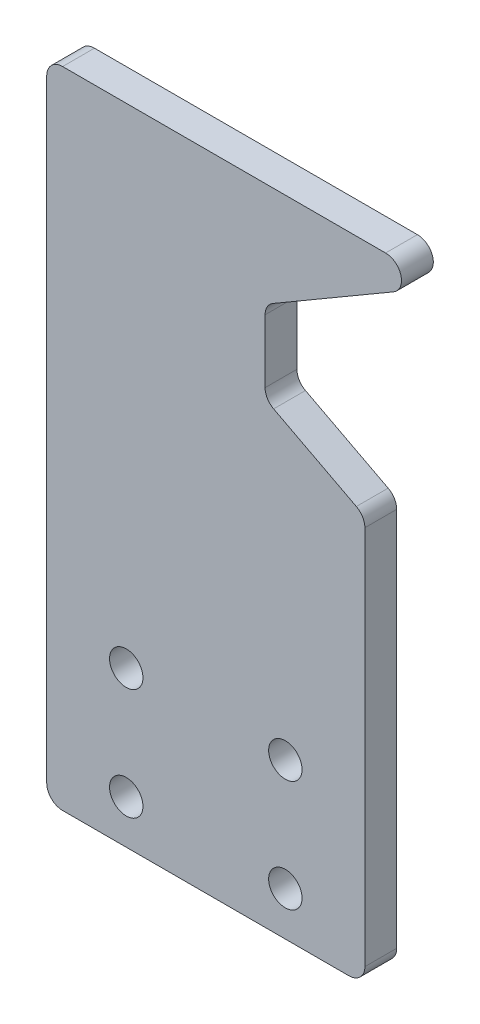
from build123d import *

# Parameters (mm, degrees)
EXTRUDE_1_DEPTH     = 4
CUT_EXTRUDE_1_REACH = 62.84
SKETCH_2_R          = 2.1
FILLET_1_R          = 2


with BuildPart() as part:
    # 草图1 → 凸台-拉伸1 (new body)
    with BuildSketch(Plane.XY):
        with BuildLine():
            Line((22.601645061, 55.5), (-20, 55.5))
            Line((-20, 55.5), (-20, 25.5))
            Line((-20, 25.5), (-20, -25.5))
            Line((-20, -25.5), (20, -25.5))
            Line((20, -25.5), (20, 25.5))
            Line((20, 25.5), (7.452886156, 32.050356938))
            Line((7.452886156, 32.050356938), (7.452886156, 42.348574365))
            Line((7.452886156, 42.348574365), (23.60932666, 51.772406935))
            ThreePointArc((23.60932666, 51.772406935), (24.53234262, 54.021926178), (22.601645061, 55.5))
        make_face()
    extrude(amount=EXTRUDE_1_DEPTH)

    # 草图2 → 切除-拉伸1 (cut, up to next)
    with BuildSketch(Plane.XY.offset(4), mode=Mode.PRIVATE) as cut_extrude_1_sk1:
        with Locations((-10, -20)):
            Circle(SKETCH_2_R)
    cut_extrude_1_tool1 = extrude(cut_extrude_1_sk1.sketch, amount=-CUT_EXTRUDE_1_REACH, mode=Mode.PRIVATE) & part.part
    # 草图2 → 切除-拉伸1 (cut, up to next)
    with BuildSketch(Plane.XY.offset(4), mode=Mode.PRIVATE) as cut_extrude_1_sk2:
        with Locations((-10, -6)):
            Circle(SKETCH_2_R)
    cut_extrude_1_tool2 = extrude(cut_extrude_1_sk2.sketch, amount=-CUT_EXTRUDE_1_REACH, mode=Mode.PRIVATE) & part.part
    # 草图2 → 切除-拉伸1 (cut, up to next)
    with BuildSketch(Plane.XY.offset(4), mode=Mode.PRIVATE) as cut_extrude_1_sk3:
        with Locations((10, -6)):
            Circle(SKETCH_2_R)
    cut_extrude_1_tool3 = extrude(cut_extrude_1_sk3.sketch, amount=-CUT_EXTRUDE_1_REACH, mode=Mode.PRIVATE) & part.part
    # 草图2 → 切除-拉伸1 (cut, up to next)
    with BuildSketch(Plane.XY.offset(4), mode=Mode.PRIVATE) as cut_extrude_1_sk4:
        with Locations((10, -20)):
            Circle(SKETCH_2_R)
    cut_extrude_1_tool4 = extrude(cut_extrude_1_sk4.sketch, amount=-CUT_EXTRUDE_1_REACH, mode=Mode.PRIVATE) & part.part
    add(cut_extrude_1_tool1.solids().sort_by_distance((-10, -20, 4))[0], mode=Mode.SUBTRACT)
    add(cut_extrude_1_tool2.solids().sort_by_distance((-10, -6, 4))[0], mode=Mode.SUBTRACT)
    add(cut_extrude_1_tool3.solids().sort_by_distance((10, -6, 4))[0], mode=Mode.SUBTRACT)
    add(cut_extrude_1_tool4.solids().sort_by_distance((10, -20, 4))[0], mode=Mode.SUBTRACT)

    # 圆角1
    fillet_1_edges = [part.edges().sort_by_distance(p)[0] for p in [
        (-20, 55.5, 2),
        (20, 25.5, 2),
        (20, -25.5, 2),
        (-20, -25.5, 2),
        (7.452886156, 42.348574365, 2),
        (7.452886156, 32.050356938, 2),
    ]]
    fillet(fillet_1_edges, radius=FILLET_1_R)


solid = part.part
